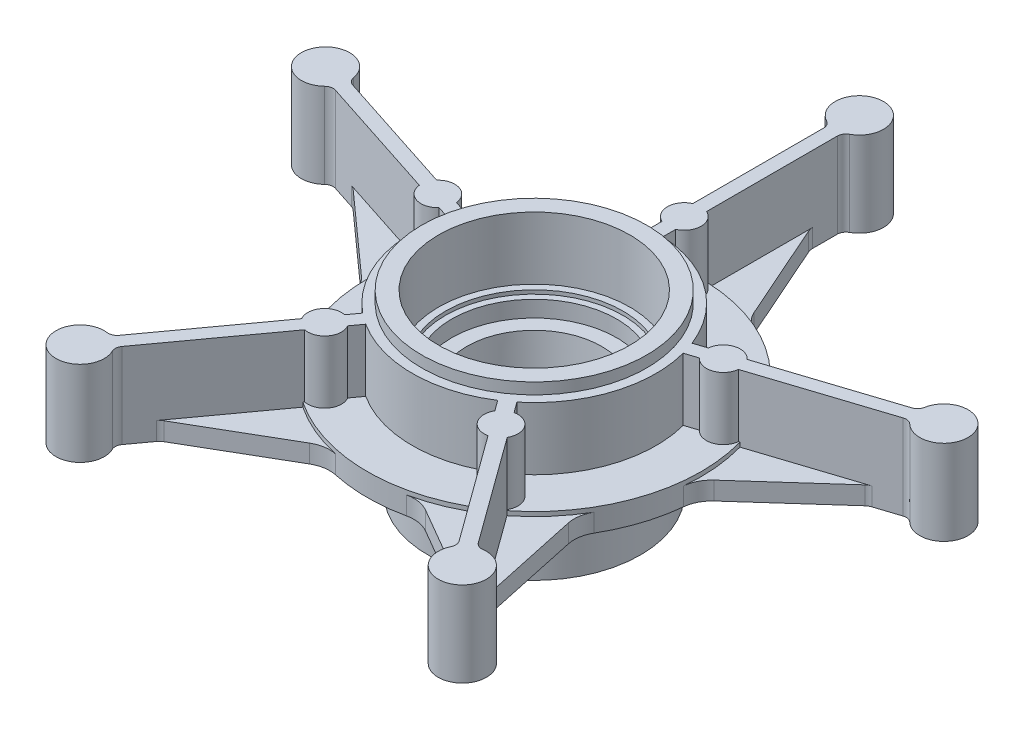
from build123d import *
from build123d.topology import SkipClean

# Parameters (mm, degrees)
BOSS_EXTRUDE1_DEPTH     = 21
CIRPATTERN1_COUNT       = 5
SKETCH3_R               = 294.674158119
SKETCH3_R_2             = 133.5
CUT_EXTRUDE1_DEPTH      = 3.5
BOSS_EXTRUDE2_START     = 68
BOSS_EXTRUDE2_DEPTH     = 68
CIRPATTERN2_COUNT       = 5
SKETCH6_R               = 312.065811201
CUT_EXTRUDE3_DEPTH      = 15
SKETCH7_R               = 90
SKETCH7_R_2             = 71
BOSS_EXTRUDE3_DEPTH     = 9
SKETCH8_R               = 76.5
CUT_EXTRUDE4_DEPTH      = 50
SKETCH9_R               = 313.84536257
SKETCH9_R_2             = 94
CUT_EXTRUDE5_DEPTH      = 3
SKETCH10_R              = 106.760596323
SKETCH10_R_2            = 85
CUT_EXTRUDE6_DEPTH      = 34
SKETCH11_R              = 112.872926099
SKETCH11_R_2            = 89.5
CUT_EXTRUDE7_DEPTH      = 30
SKETCH12_R              = 67.5
SKETCH12_R_2            = 45
BOSS_EXTRUDE4_DEPTH     = 1
CUT_EXTRUDE8_DEPTH      = 412.038532061
CUT_EXTRUDE8_DEPTH_BACK = 412.038532061
SKETCH13_R              = 48.5


with BuildPart() as part:
    # Sketch1 → Revolve1 (revolve)
    with BuildSketch(Plane.XY):
        with BuildLine():
            ThreePointArc((86.867753099, 0), (88.846350287, 0.744971582), (89.84228169, 2.60989789))
            Line((89.84228169, 2.60989789), (97.5, 61))
            Line((97.5, 61), (133.5, 61))
            Line((133.5, 61), (133.5, 82))
            Line((133.5, 82), (97.5, 82))
            Line((97.5, 82), (97.5, 147))
            Line((97.5, 147), (71, 147))
            Line((71, 147), (71, 88))
            Line((71, 88), (66, 88))
            Line((66, 88), (66, 75))
            Line((66, 75), (54, 75))
            Line((54, 75), (51.505319297, 40.981626783))
            Line((51.505319297, 40.981626783), (50.883331755, 40.539778313))
            Line((50.883331755, 40.539778313), (48.5, 0))
            Line((48.5, 0), (86.867753099, 0))
        make_face()
    revolve(axis=Axis((0, 165, 0), (0, -1, 0)))

    # Sketch2 → Boss-Extrude1 (add)
    with BuildSketch(Plane(origin=(0, 82, 0), x_dir=(1, 0, 0), z_dir=(0, 1, 0))):
        with BuildLine():
            Line((-6.35450353, 213.067894216), (-40.878618186, 135.005909342))
            ThreePointArc((-40.878618186, 135.005909342), (-46.087052335, 127.41774711), (-53.688359463, 122.228515733))
            ThreePointArc((-53.688359463, 122.228515733), (0, 133.5), (53.688359463, 122.228515733))
            ThreePointArc((53.688359463, 122.228515733), (46.087052335, 127.41774711), (40.878618186, 135.005909342))
            Line((40.878618186, 135.005909342), (6.35450353, 213.067894216))
            ThreePointArc((6.35450353, 213.067894216), (5.71595777, 215.045623904), (5.5, 217.112630835))
            Line((5.5, 217.112630835), (5.5, 236.859260412))
            ThreePointArc((5.5, 236.859260412), (6.48800918, 240.444782185), (9.173133251, 243.018152978))
            ThreePointArc((9.173133251, 243.018152978), (18.712249031, 264.730881325), (0, 279.301023339))
            ThreePointArc((0, 279.301023339), (-18.712249031, 264.730881325), (-9.173133251, 243.018152978))
            ThreePointArc((-9.173133251, 243.018152978), (-6.48800918, 240.444782185), (-5.5, 236.859260412))
            Line((-5.5, 236.859260412), (-5.5, 217.112630835))
            ThreePointArc((-5.5, 217.112630835), (-5.71595777, 215.045623904), (-6.35450353, 213.067894216))
        make_face()
    boss_extrude1 = extrude(amount=-BOSS_EXTRUDE1_DEPTH)

    # CirPattern1: Boss-Extrude1 ×5 about axis
    cirpattern1_axis = Axis((0, 165, 0), (0, 1, 0))
    for i in range(1, CIRPATTERN1_COUNT):
        add(boss_extrude1.rotate(cirpattern1_axis, i * 360 / CIRPATTERN1_COUNT))

    # Sketch3 → Cut-Extrude1 (cut)
    with BuildSketch(Plane(origin=(0, 82, 0), x_dir=(1, 0, 0), z_dir=(0, 1, 0))):
        Circle(SKETCH3_R)
        Circle(SKETCH3_R_2, mode=Mode.SUBTRACT)
    extrude(amount=-CUT_EXTRUDE1_DEPTH, mode=Mode.SUBTRACT)

    # Sketch4 → Boss-Extrude2 (add)
    with SkipClean():  # the faces are left unmerged after this step: merging them gives an invalid solid
        with BuildSketch(Plane(origin=(0, 78.5, 0), x_dir=(1, 0, 0), z_dir=(0, 1, 0)).offset(BOSS_EXTRUDE2_START)):
            with BuildLine():
                Line((-5.5, 236.859260412), (-5.5, 132.328828006))
                ThreePointArc((-5.5, 132.328828006), (-13.5, 120), (-5.5, 107.671171994))
                Line((-5.5, 107.671171994), (-5.5, 97.344748189))
                ThreePointArc((-5.5, 97.344748189), (0, 97.5), (5.5, 97.344748189))
                Line((5.5, 97.344748189), (5.5, 107.671171994))
                ThreePointArc((5.5, 107.671171994), (13.5, 120), (5.5, 132.328828006))
                Line((5.5, 132.328828006), (5.5, 236.859260412))
                ThreePointArc((5.5, 236.859260412), (6.48800918, 240.444782185), (9.173133251, 243.018152978))
                ThreePointArc((9.173133251, 243.018152978), (0, 279.301023339), (-9.173133251, 243.018152978))
                ThreePointArc((-9.173133251, 243.018152978), (-6.48800918, 240.444782185), (-5.5, 236.859260412))
            make_face()
        boss_extrude2 = extrude(amount=-BOSS_EXTRUDE2_DEPTH)
    add(part.part.scale(1), mode=Mode.REPLACE)  # the faces are merged on a copy

    # CirPattern2: Boss-Extrude2 ×5 about axis
    cirpattern2_axis = Axis((0, 165, 0), (0, 1, 0))
    for i in range(1, CIRPATTERN2_COUNT):
        add(boss_extrude2.rotate(cirpattern2_axis, i * 360 / CIRPATTERN2_COUNT))

    # Sketch6 → Cut-Extrude3 (cut)
    with BuildSketch(Plane(origin=(0, 147, 0), x_dir=(1, 0, 0), z_dir=(0, 1, 0))):
        Circle(SKETCH6_R)
    extrude(amount=-CUT_EXTRUDE3_DEPTH, mode=Mode.SUBTRACT)

    # Sketch7 → Boss-Extrude3 (add)
    with BuildSketch(Plane(origin=(0, 132, 0), x_dir=(1, 0, 0), z_dir=(0, 1, 0))):
        Circle(SKETCH7_R)
        Circle(SKETCH7_R_2, mode=Mode.SUBTRACT)
    extrude(amount=BOSS_EXTRUDE3_DEPTH)

    # Sketch8 → Cut-Extrude4 (cut)
    with BuildSketch(Plane(origin=(0, 141, 0), x_dir=(1, 0, 0), z_dir=(0, 1, 0))):
        Circle(SKETCH8_R)
    extrude(amount=-CUT_EXTRUDE4_DEPTH, mode=Mode.SUBTRACT)

    # Sketch9 → Cut-Extrude5 (cut)
    with BuildSketch(Plane.XZ.offset(-61)):
        Circle(SKETCH9_R)
        Circle(SKETCH9_R_2, mode=Mode.SUBTRACT)
    extrude(amount=-CUT_EXTRUDE5_DEPTH, mode=Mode.SUBTRACT)

    # Sketch10 → Cut-Extrude6 (cut)
    with BuildSketch(Plane.XZ):
        Circle(SKETCH10_R)
        Circle(SKETCH10_R_2, mode=Mode.SUBTRACT)
    extrude(amount=-CUT_EXTRUDE6_DEPTH, mode=Mode.SUBTRACT)

    # Sketch11 → Cut-Extrude7 (cut)
    with BuildSketch(Plane.XZ.offset(-34)):
        Circle(SKETCH11_R)
        Circle(SKETCH11_R_2, mode=Mode.SUBTRACT)
    extrude(amount=-CUT_EXTRUDE7_DEPTH, mode=Mode.SUBTRACT)

    # Sketch12 → Boss-Extrude4 (add)
    with BuildSketch(Plane.XZ):
        Circle(SKETCH12_R)
        Circle(SKETCH12_R_2, mode=Mode.SUBTRACT)
    extrude(amount=BOSS_EXTRUDE4_DEPTH)

    # Sketch13 → Cut-Extrude8 (cut, two sides: drawn at the far end of the back side and taken through both)
    with BuildSketch(Plane(origin=(0, 0, 0), x_dir=(1, 0, 0), z_dir=(0, 1, 0)).offset(-CUT_EXTRUDE8_DEPTH_BACK)):
        Circle(SKETCH13_R)
    extrude(amount=CUT_EXTRUDE8_DEPTH + CUT_EXTRUDE8_DEPTH_BACK, mode=Mode.SUBTRACT)


solid = part.part
